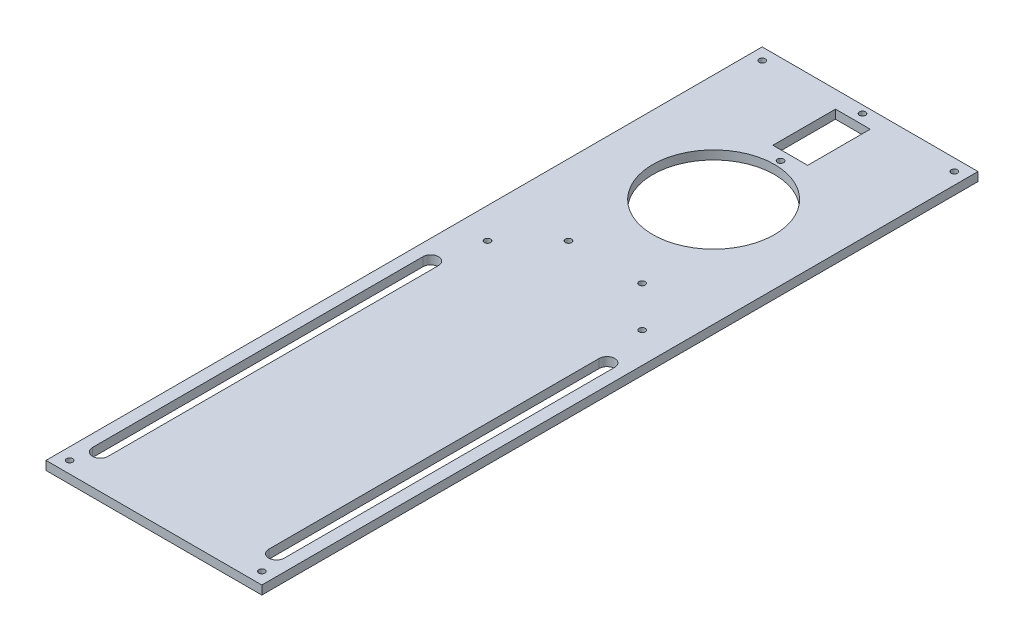
from build123d import *

# Parameters (mm, degrees)
SKETCH2_W           = 78.8444702
SKETCH2_H           = 3.2004
BOSS_EXTRUDE1_DEPTH = 261.62
SKETCH3_R           = 22.225
SKETCH3_R_2         = 1.1303
SKETCH3_W           = 12.7
SKETCH3_H           = 22.86
CUT_EXTRUDE1_DEPTH  = 266.388525487


with BuildPart() as part:
    # Sketch2 → Boss-Extrude1 (new body)
    with BuildSketch(Plane.XY):
        with Locations((-5.0277649, -1.6002)):
            Rectangle(SKETCH2_W, SKETCH2_H)
    extrude(amount=BOSS_EXTRUDE1_DEPTH)

    # Sketch3 → Cut-Extrude1 (cut, through all)
    with BuildSketch(Plane.XZ.offset(3.2004)):
        with Locations((-5.0277649, 57.15)):
            Circle(SKETCH3_R)
        with Locations((-40.132, 257.302)):
            Circle(SKETCH3_R_2)
        with Locations((30.0764702, 257.302)):
            Circle(SKETCH3_R_2)
        with Locations((-40.132, 4.318)):
            Circle(SKETCH3_R_2)
        with Locations((30.0764702, 4.318)):
            Circle(SKETCH3_R_2)
        with Locations((-5.0277649, 32.686487591)):
            Circle(SKETCH3_R_2)
        with Locations((-5.0277649, 2.765287591)):
            Circle(SKETCH3_R_2)
        with Locations((8.424210122, 96.729519922)):
            Circle(SKETCH3_R_2)
        with Locations((23.2108502, 111.51616)):
            Circle(SKETCH3_R_2)
        with Locations((-33.26638, 111.51616)):
            Circle(SKETCH3_R_2)
        with Locations((-18.479739922, 96.729519922)):
            Circle(SKETCH3_R_2)
        with BuildLine():
            Line((-40.053517537, 128.317412284), (-40.053517537, 249.024041398))
            ThreePointArc((-40.053517537, 249.024041398), (-37.219693042, 251.857865893), (-34.385868547, 249.024041398))
            Line((-34.385868547, 249.024041398), (-34.385868547, 128.317412284))
            ThreePointArc((-34.385868547, 128.317412284), (-37.219693042, 125.483587789), (-40.053517537, 128.317412284))
        make_face()
        with BuildLine():
            Line((24.330338747, 128.317412284), (24.330338747, 249.024041398))
            ThreePointArc((24.330338747, 249.024041398), (27.164163242, 251.857865893), (29.997987737, 249.024041398))
            Line((29.997987737, 249.024041398), (29.997987737, 128.317412284))
            ThreePointArc((29.997987737, 128.317412284), (27.164163242, 125.483587789), (24.330338747, 128.317412284))
        make_face()
        with Locations((-5.0277649, 17.725887591)):
            Rectangle(SKETCH3_W, SKETCH3_H)
    extrude(amount=-CUT_EXTRUDE1_DEPTH, mode=Mode.SUBTRACT)


solid = part.part
